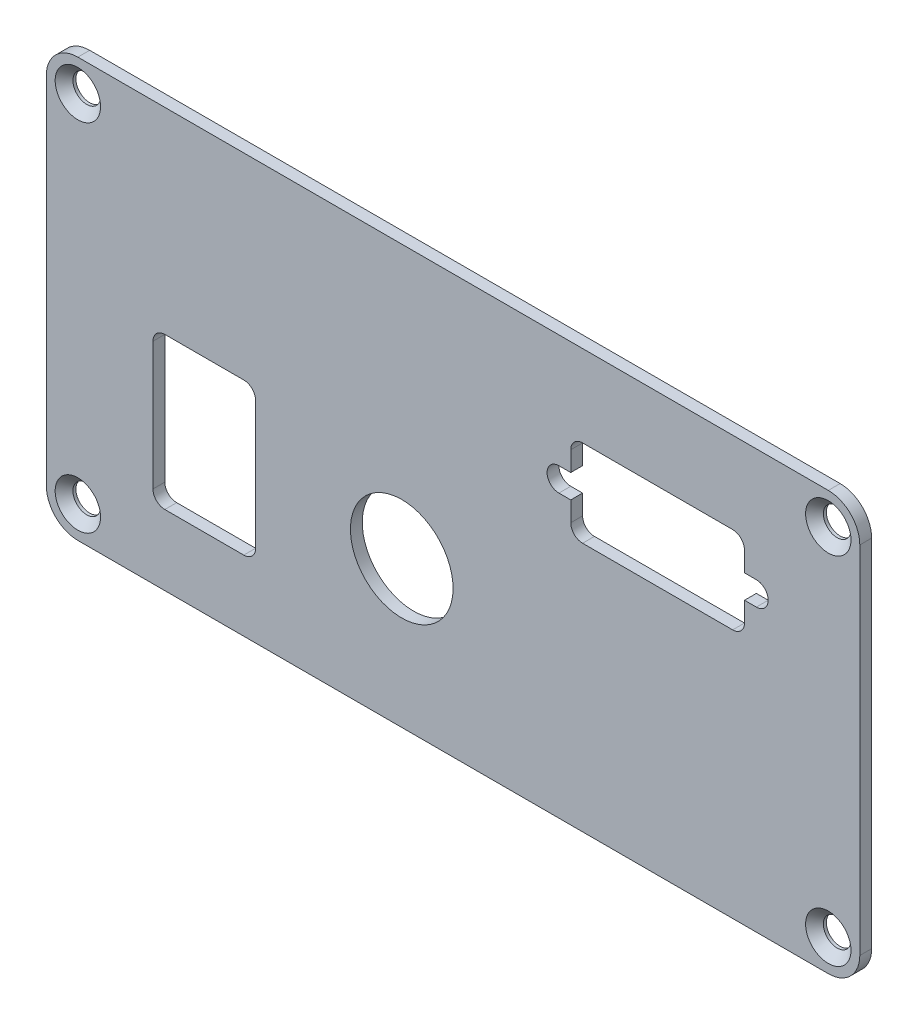
from build123d import *

# Parameters (mm, degrees)
ESQUISSE1_W                                 = 103
ESQUISSE1_H                                 = 53
BOSS_EXTRU_1_DEPTH                          = 1.5
FRAISAGE_POUR_VIS_T_TE_FRAIS_E_M31_AT_COUNT = 2
FRAISAGE_POUR_VIS_T_TE_FRAIS_E_M31_AT_PITCH = 95.02
FRAISAGE_POUR_VIS_T_TE_FRAIS_E_M31_2_COUNT  = 2
FRAISAGE_POUR_VIS_T_TE_FRAIS_E_M31_2_PITCH  = 105.137055314
FRAISAGE_POUR_VIS_T_TE_FRAIS_E_M31_3_COUNT  = 2
FRAISAGE_POUR_VIS_T_TE_FRAIS_E_M31_3_PITCH  = 45
CONG_1_R                                    = 3.99
ESQUISSE5_R                                 = 6.5
ENL_V_MAT_EXTRU_1_DEPTH                     = 58.937466289


with BuildPart() as part:
    # Esquisse1 → Boss.-Extru.1 (new body)
    with BuildSketch(Plane(origin=(0, 0, -0.75), x_dir=(-1, 0, 0), z_dir=(0, 0, -1))):
        Rectangle(ESQUISSE1_W, ESQUISSE1_H)
    extrude(amount=-BOSS_EXTRU_1_DEPTH)

    # Esquisse2 → Fraisage pour vis à tête fraisée M31 (revolve, cut)
    with BuildSketch(Plane(origin=(-47.51, 22.5, 0.75), x_dir=(0, -1, 0), z_dir=(1, 0, 0))):
        Polygon((0, 0), (0, 1.5), (1.75, 1.5), (1.75, 1.125), (2.875, 0), align=None)
    fraisage_pour_vis_t_te_frais_e_m31 = revolve(axis=Axis((-47.51, 22.5, 7.1), (0, 0, -1)), mode=Mode.SUBTRACT)

    # Fraisage pour vis à tête fraisée M31 at: Fraisage pour vis à tête fraisée M31 ×2
    with Locations(*[(i * FRAISAGE_POUR_VIS_T_TE_FRAIS_E_M31_AT_PITCH, 0, 0) for i in range(1, FRAISAGE_POUR_VIS_T_TE_FRAIS_E_M31_AT_COUNT)]):
        add(fraisage_pour_vis_t_te_frais_e_m31, mode=Mode.SUBTRACT)

    # Fraisage pour vis _ t_te frais_e M31 2: Fraisage pour vis à tête fraisée M31 ×2
    with Locations(*[Vector(0.9037726966638099, -0.4280127483674116, 0) * (i * FRAISAGE_POUR_VIS_T_TE_FRAIS_E_M31_2_PITCH) for i in range(1, FRAISAGE_POUR_VIS_T_TE_FRAIS_E_M31_2_COUNT)]):
        add(fraisage_pour_vis_t_te_frais_e_m31, mode=Mode.SUBTRACT)

    # Fraisage pour vis _ t_te frais_e M31 3: Fraisage pour vis à tête fraisée M31 ×2
    with Locations(*[(0, -i * FRAISAGE_POUR_VIS_T_TE_FRAIS_E_M31_3_PITCH, 0) for i in range(1, FRAISAGE_POUR_VIS_T_TE_FRAIS_E_M31_3_COUNT)]):
        add(fraisage_pour_vis_t_te_frais_e_m31, mode=Mode.SUBTRACT)

    # Congé1
    cong_1_edges = [part.edges().sort_by_distance(p)[0] for p in [
        (51.5, 26.5, 0),
        (51.5, -26.5, 0),
        (-51.5, 26.5, 0),
        (-51.5, -26.5, 0),
    ]]
    fillet(cong_1_edges, radius=CONG_1_R)

    # Esquisse5 → Enlèv. mat.-Extru.1 (cut, through all)
    with BuildSketch(Plane.XY.offset(0.75)):
        with Locations((-6.5, -8)):
            Circle(ESQUISSE5_R)
        with BuildLine():
            Line((-26.5, -17.6), (-36.5, -17.6))
            ThreePointArc((-36.5, -17.6), (-37.560660172, -17.160660172), (-38, -16.1))
            Line((-38, -16.1), (-38, 0.1))
            ThreePointArc((-38, 0.1), (-37.560660172, 1.160660172), (-36.5, 1.6))
            Line((-36.5, 1.6), (-26.5, 1.6))
            ThreePointArc((-26.5, 1.6), (-25.439339828, 1.160660172), (-25, 0.1))
            Line((-25, 0.1), (-25, -16.1))
            ThreePointArc((-25, -16.1), (-25.439339828, -17.160660172), (-26.5, -17.6))
        make_face()
        with BuildLine():
            Line((35.4, 5.15), (16.4, 5.15))
            ThreePointArc((16.4, 5.15), (15.339339828, 5.589339828), (14.9, 6.65))
            Line((14.9, 6.65), (14.9, 9.15))
            Line((14.9, 9.15), (13.4, 9.15))
            ThreePointArc((13.4, 9.15), (11.9, 10.65), (13.4, 12.15))
            Line((13.4, 12.15), (14.9, 12.15))
            Line((14.9, 12.15), (14.9, 14.65))
            ThreePointArc((14.9, 14.65), (15.339339828, 15.710660172), (16.4, 16.15))
            Line((16.4, 16.15), (35.4, 16.15))
            ThreePointArc((35.4, 16.15), (36.460660172, 15.710660172), (36.9, 14.65))
            Line((36.9, 14.65), (36.9, 12.15))
            Line((36.9, 12.15), (38.4, 12.15))
            ThreePointArc((38.4, 12.15), (39.9, 10.65), (38.4, 9.15))
            Line((38.4, 9.15), (36.9, 9.15))
            Line((36.9, 9.15), (36.9, 6.65))
            ThreePointArc((36.9, 6.65), (36.460660172, 5.589339828), (35.4, 5.15))
        make_face()
    extrude(amount=-ENL_V_MAT_EXTRU_1_DEPTH, mode=Mode.SUBTRACT)


solid = part.part
